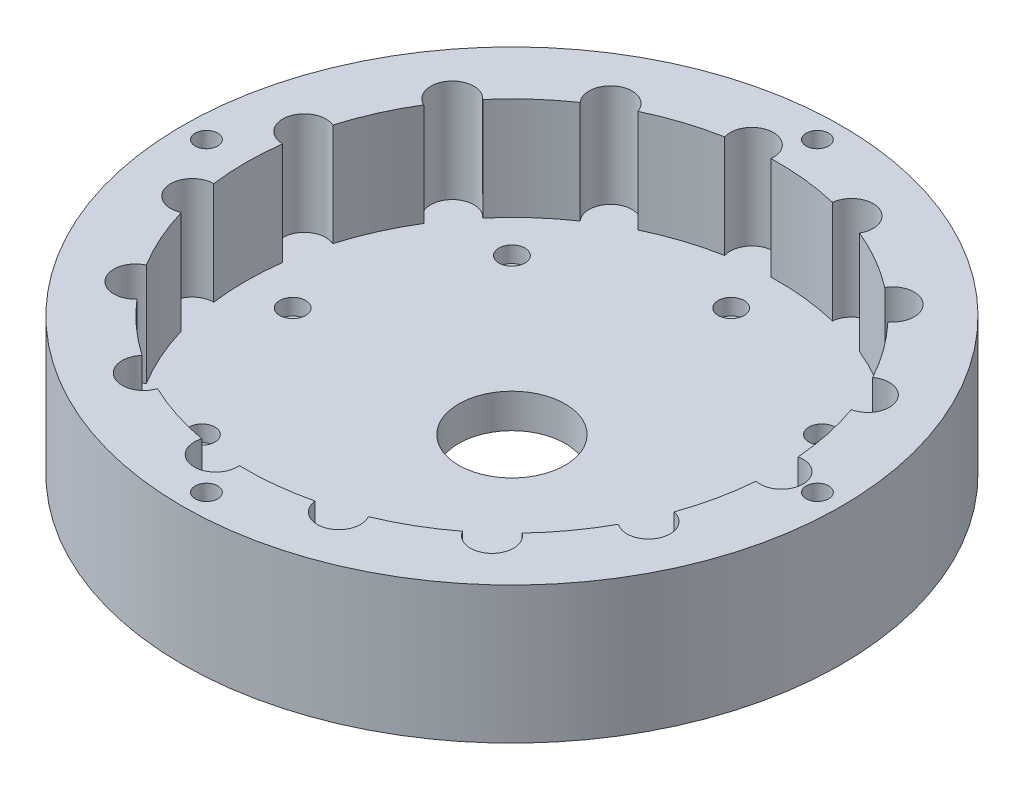
from build123d import *

# Parameters (mm, degrees)
SKETCH1_R           = 45.85
SKETCH1_R_2         = 1.5635
SKETCH1_R_3         = 7.4
BOSS_EXTRUDE1_DEPTH = 4.7625
SKETCH1_6_R         = 1.8125
CUT_EXTRUDE1_DEPTH  = 2.2467
BOSS_EXTRUDE2_START = 14.2875
SKETCH1_7_R         = 45.85
SKETCH1_7_R_2       = 1.5635
BOSS_EXTRUDE2_DEPTH = 14.2875


with BuildPart() as part:
    # Sketch1 → Boss-Extrude1 (new body)
    with BuildSketch(Plane(origin=(0, 0, 0), x_dir=(1, 0, 0), z_dir=(0, 1, 0))):
        Circle(SKETCH1_R)
        with Locations((0, -42.5)):
            Circle(SKETCH1_R_2, mode=Mode.SUBTRACT)
        with Locations((-42.5, 0)):
            Circle(SKETCH1_R_2, mode=Mode.SUBTRACT)
        with Locations((42.5, 0)):
            Circle(SKETCH1_R_2, mode=Mode.SUBTRACT)
        with Locations((0, 42.5)):
            Circle(SKETCH1_R_2, mode=Mode.SUBTRACT)
        Circle(SKETCH1_R_3, mode=Mode.SUBTRACT)
    extrude(amount=-BOSS_EXTRUDE1_DEPTH)

    # Sketch1<6> → Cut-Extrude1 (cut)
    with BuildSketch(Plane(origin=(0, 0, 0), x_dir=(1, 0, 0), z_dir=(0, 1, 0))):
        with Locations((30.5, 0)):
            Circle(SKETCH1_6_R)
        with Locations((21.566756826, -21.566756826)):
            Circle(SKETCH1_6_R)
        with Locations((0, -30.5)):
            Circle(SKETCH1_6_R)
        with Locations((-21.566756826, -21.566756826)):
            Circle(SKETCH1_6_R)
        with Locations((-30.5, 0)):
            Circle(SKETCH1_6_R)
        with Locations((-21.566756826, 21.566756826)):
            Circle(SKETCH1_6_R)
        with Locations((0, 30.5)):
            Circle(SKETCH1_6_R)
        with Locations((21.566756826, 21.566756826)):
            Circle(SKETCH1_6_R)
    extrude(amount=-CUT_EXTRUDE1_DEPTH, mode=Mode.SUBTRACT)

    # Sketch1<7> → Boss-Extrude2 (add)
    with BuildSketch(Plane(origin=(0, 0, 0), x_dir=(1, 0, 0), z_dir=(0, 1, 0)).offset(BOSS_EXTRUDE2_START)):
        Circle(SKETCH1_7_R)
        with Locations((0, -42.5)):
            Circle(SKETCH1_7_R_2, mode=Mode.SUBTRACT)
        with Locations((-42.5, 0)):
            Circle(SKETCH1_7_R_2, mode=Mode.SUBTRACT)
        with Locations((42.5, 0)):
            Circle(SKETCH1_7_R_2, mode=Mode.SUBTRACT)
        with BuildLine():
            ThreePointArc((36.883333333, 2.935936345), (39.39076704, 2.32916294), (40.5, 0))
            ThreePointArc((40.5, 0), (39.39076704, -2.32916294), (36.883333333, -2.935936345))
            ThreePointArc((36.883333333, -2.935936345), (36.191461227, -7.69273256), (34.888754523, -12.319691873))
            ThreePointArc((34.888754523, -12.319691873), (36.59166411, -13.367471546), (37.257954662, -15.252624115))
            ThreePointArc((37.257954662, -15.252624115), (35.6231437, -17.924001829), (32.500448736, -17.683914497))
            ThreePointArc((32.500448736, -17.683914497), (29.933628792, -21.748054335), (26.861593101, -25.445133446))
            ThreePointArc((26.861593101, -25.445133446), (27.767055295, -26.50917897), (28.092397738, -27.867930955))
            ThreePointArc((28.092397738, -27.867930955), (25.872343464, -30.764771418), (22.497941295, -29.37418318))
            ThreePointArc((22.497941295, -29.37418318), (18.5, -32.04293994), (14.189818202, -34.170880284))
            ThreePointArc((14.189818202, -34.170880284), (14.486847583, -34.891651942), (14.588137289, -35.664619361))
            ThreePointArc((14.588137289, -35.664619361), (11.748752331, -38.660316744), (8.605335417, -35.985388734))
            ThreePointArc((8.605335417, -35.985388734), (3.867553141, -36.797310129), (-0.935505175, -36.988171489))
            ThreePointArc((-0.935505175, -36.988171489), (-0.92374189, -37.141170608), (-0.919817373, -37.294571076))
            ThreePointArc((-0.919817373, -37.294571076), (-4.385552663, -40.258199029), (-6.775211132, -36.37439366))
            ThreePointArc((-6.775211132, -36.37439366), (-11.433628792, -35.189091103), (-15.899071208, -33.409871815))
            ThreePointArc((-15.899071208, -33.409871815), (-20.25, -35.074028853), (-20.984262125, -30.47393547))
            ThreePointArc((-20.984262125, -30.47393547), (-24.757832435, -27.496358543), (-28.113543391, -24.054701786))
            ThreePointArc((-28.113543391, -24.054701786), (-32.765188272, -23.805302718), (-31.564943561, -19.304256991))
            ThreePointArc((-31.564943561, -19.304256991), (-33.801181933, -15.049255794), (-35.466928517, -10.540255288))
            ThreePointArc((-35.466928517, -10.540255288), (-39.61497783, -8.420423478), (-36.687759497, -4.796697105))
            ThreePointArc((-36.687759497, -4.796697105), (-37, 0), (-36.687759497, 4.796697105))
            ThreePointArc((-36.687759497, 4.796697105), (-39.61497783, 8.420423478), (-35.466928517, 10.540255288))
            ThreePointArc((-35.466928517, 10.540255288), (-33.801181933, 15.049255794), (-31.564943561, 19.304256991))
            ThreePointArc((-31.564943561, 19.304256991), (-32.765188272, 23.805302718), (-28.113543391, 24.054701786))
            ThreePointArc((-28.113543391, 24.054701786), (-24.757832435, 27.496358543), (-20.984262125, 30.47393547))
            ThreePointArc((-20.984262125, 30.47393547), (-20.25, 35.074028853), (-15.899071208, 33.409871815))
            ThreePointArc((-15.899071208, 33.409871815), (-11.433628792, 35.189091103), (-6.775211132, 36.37439366))
            ThreePointArc((-6.775211132, 36.37439366), (-4.385552663, 40.258199029), (-0.919817373, 37.294571076))
            ThreePointArc((-0.919817373, 37.294571076), (-0.92374189, 37.141170608), (-0.935505175, 36.988171489))
            ThreePointArc((-0.935505175, 36.988171489), (3.867553141, 36.797310129), (8.605335417, 35.985388734))
            ThreePointArc((8.605335417, 35.985388734), (11.748752331, 38.660316744), (14.588137289, 35.664619361))
            ThreePointArc((14.588137289, 35.664619361), (14.486847583, 34.891651942), (14.189818202, 34.170880284))
            ThreePointArc((14.189818202, 34.170880284), (18.5, 32.04293994), (22.497941295, 29.37418318))
            ThreePointArc((22.497941295, 29.37418318), (25.872343464, 30.764771418), (28.092397738, 27.867930955))
            ThreePointArc((28.092397738, 27.867930955), (27.767055295, 26.50917897), (26.861593101, 25.445133446))
            ThreePointArc((26.861593101, 25.445133446), (29.933628792, 21.748054335), (32.500448736, 17.683914497))
            ThreePointArc((32.500448736, 17.683914497), (35.6231437, 17.924001829), (37.257954662, 15.252624115))
            ThreePointArc((37.257954662, 15.252624115), (36.59166411, 13.367471546), (34.888754523, 12.319691873))
            ThreePointArc((34.888754523, 12.319691873), (36.191461227, 7.69273256), (36.883333333, 2.935936345))
        make_face(mode=Mode.SUBTRACT)
        with Locations((0, 42.5)):
            Circle(SKETCH1_7_R_2, mode=Mode.SUBTRACT)
    extrude(amount=-BOSS_EXTRUDE2_DEPTH)


solid = part.part
